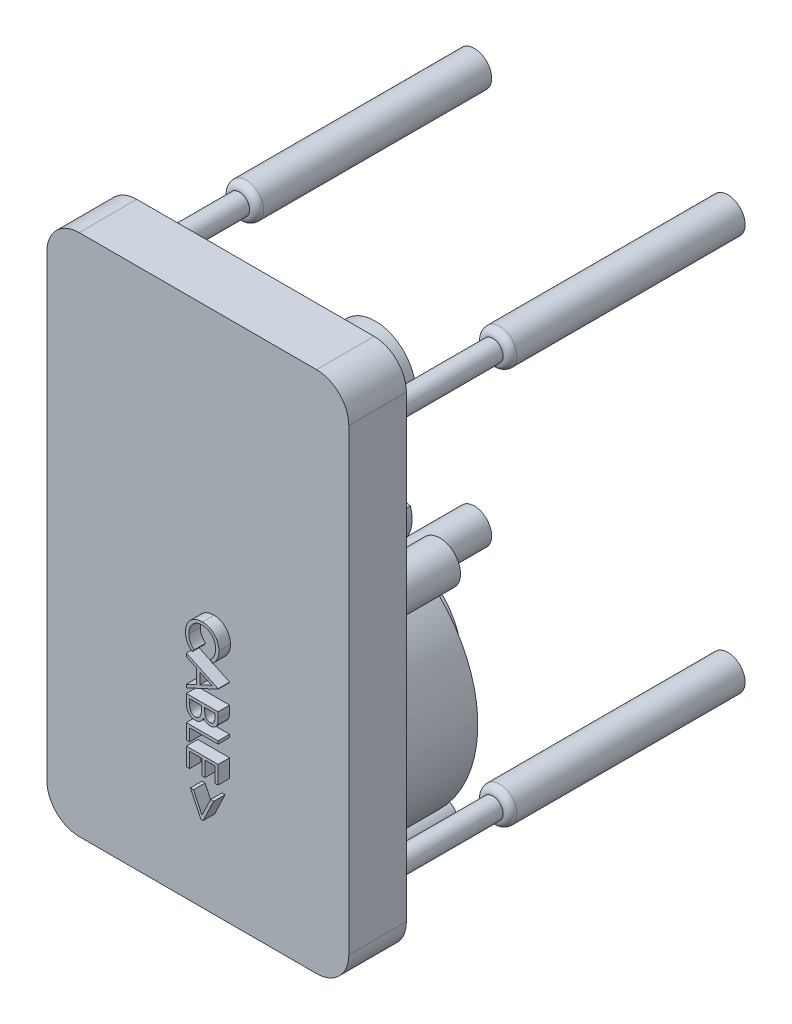
from build123d import *
from build123d.topology import SkipClean

# Parameters (mm, degrees)
SKETCH1_R             = 7.239
BOSS_EXTRUDE1_DEPTH   = 10.16
SKETCH2_R             = 6.35
BOSS_EXTRUDE2_DEPTH   = 1.778
SKETCH3_R             = 2.286
BOSS_EXTRUDE3_DEPTH   = 1.27
BOSS_EXTRUDE4_DEPTH   = 3.302
SKETCH5_R             = 4.445
BOSS_EXTRUDE5_DEPTH   = 11.43
SKETCH6_R             = 1.143
BOSS_EXTRUDE6_DEPTH   = 38.1
BOSS_EXTRUDE6_2_DEPTH = 38.1
BOSS_EXTRUDE6_3_DEPTH = 38.1
BOSS_EXTRUDE6_4_DEPTH = 38.1
SKETCH7_R             = 7.239
BOSS_EXTRUDE7_DEPTH   = 5.334
BOSS_EXTRUDE8_DEPTH   = 6.35
SKETCH9_R             = 1.905
BOSS_EXTRUDE9_DEPTH   = 25.908
BOSS_EXTRUDE10_DEPTH  = 1.27
FILLET1_R             = 0.762


with BuildPart() as part:
    # Sketch1 → Boss-Extrude1 (new body)
    # profile 1 of 7: a face of its own
    with BuildSketch(Plane.XY):
        with BuildLine():
            ThreePointArc((10.064128852, -22.930567504), (13.235964532, -18.24620987), (14.351, -12.7))
            ThreePointArc((14.351, -12.7), (13.235964532, -7.15379013), (10.064128852, -2.469432496))
            ThreePointArc((10.064128852, -2.469432496), (8.455209632, -1.104283934), (6.663505747, 0.010188518))
            ThreePointArc((6.663505747, 0.010188518), (5.175517983, 0.685261096), (3.62043784, 1.186815))
            ThreePointArc((3.62043784, 1.186815), (0, -3.81), (-3.62043784, 1.186815))
            ThreePointArc((-3.62043784, 1.186815), (-5.175517983, 0.685261096), (-6.663505747, 0.010188518))
            ThreePointArc((-6.663505747, 0.010188518), (-8.455209632, -1.104283934), (-10.064128852, -2.469432496))
            ThreePointArc((-10.064128852, -2.469432496), (-14.351, -12.7), (-10.064128852, -22.930567504))
            ThreePointArc((-10.064128852, -22.930567504), (-8.455209632, -24.295716066), (-6.663505747, -25.410188518))
            ThreePointArc((-6.663505747, -25.410188518), (0, -27.051), (6.663505747, -25.410188518))
            ThreePointArc((6.663505747, -25.410188518), (8.455209632, -24.295716066), (10.064128852, -22.930567504))
        make_face()
        with Locations((0, -12.7)):
            Circle(SKETCH1_R, mode=Mode.SUBTRACT)
    # profile 2 of 7: a face of its own
    with BuildSketch(Plane.XY):
        with BuildLine():
            ThreePointArc((-10.064128852, -2.469432496), (-8.455209632, -1.104283934), (-6.663505747, 0.010188518))
            ThreePointArc((-6.663505747, 0.010188518), (-10.236847552, 1.339105214), (-10.064128852, -2.469432496))
        make_face()
    # profile 3 of 7: a face of its own
    with BuildSketch(Plane.XY):
        with BuildLine():
            ThreePointArc((-3.62043784, 1.186815), (0, -3.81), (3.62043784, 1.186815))
            ThreePointArc((3.62043784, 1.186815), (0, 1.651), (-3.62043784, 1.186815))
        make_face()
    # profile 4 of 7: a face of its own
    with BuildSketch(Plane.XY):
        with BuildLine():
            ThreePointArc((6.663505747, 0.010188518), (8.455209632, -1.104283934), (10.064128852, -2.469432496))
            ThreePointArc((10.064128852, -2.469432496), (10.236847552, 1.339105214), (6.663505747, 0.010188518))
        make_face()
    # profile 5 of 7: a face of its own
    with BuildSketch(Plane.XY):
        with BuildLine():
            ThreePointArc((6.663505747, -25.410188518), (10.236847552, -26.739105214), (10.064128852, -22.930567504))
            ThreePointArc((10.064128852, -22.930567504), (8.455209632, -24.295716066), (6.663505747, -25.410188518))
        make_face()
    # profile 6 of 7: a face of its own
    with BuildSketch(Plane.XY):
        with BuildLine():
            ThreePointArc((-10.064128852, -22.930567504), (-10.236847552, -26.739105214), (-6.663505747, -25.410188518))
            ThreePointArc((-6.663505747, -25.410188518), (-8.455209632, -24.295716066), (-10.064128852, -22.930567504))
        make_face()
    # profile 7 of 7: a face of its own
    with BuildSketch(Plane.XY):
        with Locations((0, -12.7)):
            Circle(SKETCH1_R)
    extrude(amount=-BOSS_EXTRUDE1_DEPTH)

    # Sketch3 → Boss-Extrude3 (add)
    with SkipClean():  # the faces are left unmerged after this step: merging them gives an invalid solid
        with BuildSketch(Plane(origin=(0, 0, -10.16), x_dir=(-1, 0, 0), z_dir=(0, 0, -1))):
            with Locations(Location((-8.89, -0.508, 0), (0, 0, 239.094930529))):
                Circle(SKETCH3_R)
            with Locations(Location((8.89, -24.892, 0), (0, 0, 193.101637405))):
                Circle(SKETCH3_R)
            with Locations(Location((-8.89, -24.892, 0), (0, 0, 120.905069471))):
                Circle(SKETCH3_R)
            with Locations(Location((8.89, -0.508, 0), (0, 0, 166.898362595))):
                Circle(SKETCH3_R)
        extrude(amount=BOSS_EXTRUDE3_DEPTH)

    # Sketch4 → Boss-Extrude4 (add)
    with SkipClean():  # the faces are left unmerged after this step: merging them gives an invalid solid
        with BuildSketch(Plane(origin=(0, 0, -10.16), x_dir=(-1, 0, 0), z_dir=(0, 0, -1))):
            with BuildLine():
                ThreePointArc((-3.62043784, 1.186815), (0, -3.81), (3.62043784, 1.186815))
                ThreePointArc((3.62043784, 1.186815), (0, 1.651), (-3.62043784, 1.186815))
            make_face()
        extrude(amount=BOSS_EXTRUDE4_DEPTH)

    # Sketch7 → Boss-Extrude7 (add)
    with SkipClean():  # the faces are left unmerged after this step: merging them gives an invalid solid
        with BuildSketch(Plane(origin=(0, 0, -10.16), x_dir=(-1, 0, 0), z_dir=(0, 0, -1))):
            with Locations(Location((0, -12.7, 0), (0, 0, 180))):
                Circle(SKETCH7_R)
        extrude(amount=BOSS_EXTRUDE7_DEPTH)



with BuildPart() as body_2:
    # Sketch2 → Boss-Extrude2 (new body)
    with BuildSketch(Plane.XY):
        with Locations((0, 14.605)):
            Circle(SKETCH2_R)
    extrude(amount=-BOSS_EXTRUDE2_DEPTH)

    # Sketch5 → Boss-Extrude5 (add)
    with BuildSketch(Plane(origin=(0, 0, -1.778), x_dir=(-1, 0, 0), z_dir=(0, 0, -1))):
        with Locations(Location((0, 12.7, 0), (0, 0, 269.999298311))):
            Circle(SKETCH5_R)
    extrude(amount=BOSS_EXTRUDE5_DEPTH)


with BuildPart() as body_3:
    # Sketch6 → Boss-Extrude6 (new body)
    with BuildSketch(Plane.XY):
        with Locations((-13.97, 21.844)):
            Circle(SKETCH6_R)
    extrude(amount=-BOSS_EXTRUDE6_DEPTH)


with BuildPart() as body_4:
    # Sketch6 → Boss-Extrude6 2 (new body)
    with BuildSketch(Plane.XY):
        with Locations((13.97, 21.844)):
            Circle(SKETCH6_R)
    extrude(amount=-BOSS_EXTRUDE6_2_DEPTH)


with BuildPart() as body_5:
    # Sketch6 → Boss-Extrude6 3 (new body)
    with BuildSketch(Plane.XY):
        with Locations((-13.97, -21.844)):
            Circle(SKETCH6_R)
    extrude(amount=-BOSS_EXTRUDE6_3_DEPTH)


with BuildPart() as body_6:
    # Sketch6 → Boss-Extrude6 4 (new body)
    with BuildSketch(Plane.XY):
        with Locations((13.97, -21.844)):
            Circle(SKETCH6_R)
    extrude(amount=-BOSS_EXTRUDE6_4_DEPTH)


with BuildPart() as part_1:
    with SkipClean():  # the faces are left unmerged after this step: merging them gives an invalid solid
        add(part.part)

        add(body_2.part)  # Boss-Extrude8 merges body 2

        add(body_3.part)  # Boss-Extrude8 merges body 3

        add(body_4.part)  # Boss-Extrude8 merges body 4

        add(body_5.part)  # Boss-Extrude8 merges body 5

        add(body_6.part)  # Boss-Extrude8 merges body 6
        # Sketch8 → Boss-Extrude8 (add)
        with BuildSketch(Plane.XY):
            with BuildLine():
                Line((-13.081, 28.829), (13.081, 28.829))
                ThreePointArc((13.081, 28.829), (15.595471714, 27.787471714), (16.637, 25.273))
                Line((16.637, 25.273), (16.637, -25.273))
                ThreePointArc((16.637, -25.273), (15.595471714, -27.787471714), (13.081, -28.829))
                Line((13.081, -28.829), (-13.081, -28.829))
                ThreePointArc((-13.081, -28.829), (-15.595471714, -27.787471714), (-16.637, -25.273))
                Line((-16.637, -25.273), (-16.637, 25.273))
                ThreePointArc((-16.637, 25.273), (-15.595471714, 27.787471714), (-13.081, 28.829))
            make_face()
        extrude(amount=BOSS_EXTRUDE8_DEPTH)

    # Sketch9 → Boss-Extrude9 (add)
    with SkipClean():  # the faces are left unmerged after this step: merging them gives an invalid solid
        with BuildSketch(Plane(origin=(0, 0, -38.1), x_dir=(-1, 0, 0), z_dir=(0, 0, -1))):
            with Locations((-13.97, 21.844)):
                Circle(SKETCH9_R)
            with Locations((13.97, 21.844)):
                Circle(SKETCH9_R)
            with Locations((13.97, -21.844)):
                Circle(SKETCH9_R)
            with Locations((-13.97, -21.844)):
                Circle(SKETCH9_R)
        extrude(amount=-BOSS_EXTRUDE9_DEPTH)

    # Sketch10 → Boss-Extrude10 (add)
    # profile 1 of 6: a face of its own
    with SkipClean():  # the faces are left unmerged after this step: merging them gives an invalid solid
        with BuildSketch(Plane.XY.offset(6.35)):
            with BuildLine():
                Line((2.857772436, -3.679487179), (2.647435897, -3.404647436))
                add(Edge.make_bspline(
                    [(2.647435897, -3.404647436), (2.670801867, -3.385041548), (2.717218783, -3.346094101), (2.782398327, -3.283434898), (2.843463589, -3.218133255), (2.900705469, -3.150214134), (2.952122234, -3.078455015), (3.000393337, -3.004594216), (3.043661075, -2.927396171), (3.096124061, -2.820644436), (3.150870216, -2.680996588), (3.196773448, -2.505201749), (3.225994623, -2.32169065), (3.229159465, -2.196493051), (3.230769231, -2.1328125)],
                    knots=[0, 0, 0, 0, 0.757959112, 1.505699292, 2.245454638, 2.979532153, 3.711538275, 4.438200793, 5.171680507, 5.909471876, 7.393775596, 8.890124382, 10.418191784, 12, 12, 12, 12], degree=3))
                add(Edge.make_bspline(
                    [(3.230769231, -2.1328125), (3.230363445, -2.097729627), (3.229555641, -2.027889483), (3.218973416, -1.924234716), (3.20392868, -1.822319184), (3.1821483, -1.722521872), (3.153792222, -1.625040935), (3.120538112, -1.529134135), (3.079156746, -1.435930999), (3.033456552, -1.34430985), (2.981823731, -1.256534692), (2.925523467, -1.173466714), (2.865108338, -1.095485416), (2.800734294, -1.02237471), (2.731601295, -0.954936411), (2.658522608, -0.892089722), (2.580618642, -0.834967287), (2.499350418, -0.782165421), (2.41459849, -0.735181205), (2.326896016, -0.694608059), (2.236578315, -0.6598335), (2.143460367, -0.632062149), (2.047908611, -0.610157149), (1.949720267, -0.59502418), (1.849085923, -0.584537152), (1.780876701, -0.583736779), (1.746494391, -0.583333333)],
                    knots=[0, 0, 0, 0, 1.055000685, 2.100209969, 3.131349012, 4.153242145, 5.170189196, 6.184191144, 7.204341339, 8.235672124, 9.263040994, 10.265373269, 11.252624173, 12.22887325, 13.193405896, 14.155809299, 15.126090485, 16.097288279, 17.069732292, 18.038585918, 19.002221264, 19.978698174, 20.959418239, 21.948869816, 22.966084182, 24, 24, 24, 24], degree=3))
                add(Edge.make_bspline(
                    [(1.746494391, -0.583333333), (1.694763071, -0.584595152), (1.593195486, -0.587072567), (1.444424876, -0.609120901), (1.301904202, -0.642625992), (1.16652436, -0.692841569), (1.036616002, -0.75476062), (0.914377148, -0.833001231), (0.797960584, -0.923617768), (0.690117636, -1.027892188), (0.591603911, -1.142298004), (0.504853329, -1.265045915), (0.432538447, -1.395830203), (0.3723625, -1.533206833), (0.326105772, -1.678232947), (0.293541649, -1.83064775), (0.272299468, -1.990119745), (0.27026578, -2.099089145), (0.269230769, -2.154547276)],
                    knots=[0, 0, 0, 0, 1.029171465, 2.020641659, 2.987623507, 3.938342917, 4.889210282, 5.84687017, 6.821220943, 7.821438502, 8.827599549, 9.822697543, 10.807740252, 11.797342354, 12.80366471, 13.83203677, 14.896651826, 16, 16, 16, 16], degree=3))
                add(Edge.make_bspline(
                    [(0.269230769, -2.154547276), (0.270919549, -2.215649965), (0.274243472, -2.335914674), (0.302402721, -2.5122827), (0.348060638, -2.681118466), (0.411958561, -2.842431052), (0.495023849, -2.995765698), (0.595721726, -3.141362359), (0.715010059, -3.279343929), (0.806093187, -3.362315211), (0.852564103, -3.404647436)],
                    knots=[0, 0, 0, 0, 1.028121516, 2.023589091, 2.998037872, 3.967518031, 4.937445131, 5.927275754, 6.942489185, 8, 8, 8, 8], degree=3))
                Line((0.852564103, -3.404647436), (0.644330929, -3.679487179))
                add(Edge.make_bspline(
                    [(0.644330929, -3.679487179), (0.615792429, -3.657369099), (0.558852125, -3.613238882), (0.478581139, -3.54178043), (0.403074401, -3.466504759), (0.332956835, -3.386842997), (0.266764666, -3.303747898), (0.206716932, -3.215755784), (0.150984484, -3.12438645), (0.100628049, -3.02910793), (0.05547798, -2.930233036), (0.017361042, -2.827864665), (-0.015946051, -2.722870088), (-0.04316627, -2.615196429), (-0.064445988, -2.50448398), (-0.078663293, -2.391112597), (-0.088405847, -2.274842967), (-0.089293675, -2.196401513), (-0.08974359, -2.156650641)],
                    knots=[0, 0, 0, 0, 0.986756325, 1.968786143, 2.935506311, 3.899499537, 4.868307269, 5.8376204, 6.809456583, 7.792545619, 8.781780509, 9.778496008, 10.776623214, 11.79151764, 12.812666265, 13.856269958, 14.913646641, 16, 16, 16, 16], degree=3))
                add(Edge.make_bspline(
                    [(-0.08974359, -2.156650641), (-0.089481597, -2.119006974), (-0.088963539, -2.044571284), (-0.080571372, -1.934672532), (-0.069121635, -1.827682951), (-0.051881504, -1.723908326), (-0.031537164, -1.622782351), (-0.004265907, -1.525221766), (0.026283259, -1.430266556), (0.062188246, -1.338298215), (0.102704429, -1.249238515), (0.148495987, -1.163374704), (0.199177852, -1.080746271), (0.253632863, -1.000540851), (0.313610164, -0.923943267), (0.378276799, -0.850289742), (0.44741481, -0.779167265), (0.497269663, -0.73516458), (0.522335737, -0.713040865)],
                    knots=[0, 0, 0, 0, 1.114604814, 2.203992996, 3.262667896, 4.300477797, 5.318619304, 6.316056647, 7.298880507, 8.271930387, 9.238335007, 10.195173496, 11.151986948, 12.108099108, 13.064862484, 14.031167946, 15.010108607, 16, 16, 16, 16], degree=3))
                add(Edge.make_bspline(
                    [(0.522335737, -0.713040865), (0.565876926, -0.677605222), (0.652433637, -0.607161745), (0.792719618, -0.517036062), (0.939187827, -0.439888506), (1.092607755, -0.377512586), (1.252635143, -0.328749852), (1.419350657, -0.294968657), (1.592598599, -0.273017053), (1.710435388, -0.270506764), (1.770332532, -0.269230769)],
                    knots=[0, 0, 0, 0, 0.994628077, 1.977248131, 2.950237994, 3.925870899, 4.908910175, 5.911660606, 6.938484602, 8, 8, 8, 8], degree=3))
                add(Edge.make_bspline(
                    [(1.770332532, -0.269230769), (1.833285352, -0.270792919), (1.957141094, -0.27386635), (2.138952641, -0.299762866), (2.312890308, -0.341927395), (2.479623367, -0.399988234), (2.638197835, -0.476586004), (2.789283438, -0.569313798), (2.93275681, -0.679077345), (3.066783632, -0.804498118), (3.18931972, -0.9420727), (3.297126777, -1.089389619), (3.386844068, -1.246172066), (3.461840291, -1.410689784), (3.519484737, -1.584175502), (3.559837929, -1.766258861), (3.584955044, -1.956597778), (3.588130252, -2.086460203), (3.58974359, -2.15244391)],
                    knots=[0, 0, 0, 0, 1.032901378, 2.032168977, 3.007206631, 3.966850309, 4.924221947, 5.891988639, 6.871730993, 7.884084801, 8.900290346, 9.89161143, 10.874607481, 11.860025555, 12.854717796, 13.869097222, 14.917278314, 16, 16, 16, 16], degree=3))
                add(Edge.make_bspline(
                    [(3.58974359, -2.15244391), (3.589261812, -2.192658461), (3.588308181, -2.272259114), (3.578996816, -2.390010625), (3.563502411, -2.50465715), (3.542274027, -2.616475949), (3.516255146, -2.725872498), (3.482194419, -2.83172447), (3.442641565, -2.934608269), (3.39824916, -3.03460095), (3.347498469, -3.130614623), (3.292377899, -3.222631813), (3.231615083, -3.309542503), (3.167218841, -3.392981488), (3.096780331, -3.471070292), (3.022593437, -3.546039113), (2.942456775, -3.615298244), (2.886052222, -3.658051701), (2.857772436, -3.679487179)],
                    knots=[0, 0, 0, 0, 1.096705196, 2.170817488, 3.219277236, 4.250701065, 5.274195539, 6.284202015, 7.28098643, 8.279664616, 9.266225751, 10.241373748, 11.203306326, 12.157093976, 13.114198862, 14.069774147, 15.032234603, 16, 16, 16, 16], degree=3))
            make_face()
        # profile 2 of 6: a face of its own
        with BuildSketch(Plane.XY.offset(6.35)):
            Polygon((3.5, -5.833333333), (0, -7.448717949), (0, -7.107271635), (1.121794872, -6.58984375), (1.121794872, -5.003205128), (0, -4.471053686), (0, -4.128205128), (3.5, -5.788461538), align=None)
            Polygon((2.817808494, -5.807391827), (1.480769231, -5.173577724), (1.480769231, -6.424379006), align=None, mode=Mode.SUBTRACT)
        # profile 3 of 6: a face of its own
        with BuildSketch(Plane.XY.offset(6.35)):
            with BuildLine():
                Line((3.5, -7.987179487), (3.5, -8.670072115))
                add(Edge.make_bspline(
                    [(3.5, -8.670072115), (3.49982425, -8.703500594), (3.499483602, -8.768293304), (3.49420047, -8.862512746), (3.486996801, -8.950761556), (3.475566708, -9.033065329), (3.461774931, -9.109386031), (3.445073115, -9.179953668), (3.425046501, -9.244543841), (3.39320022, -9.321656577), (3.345877051, -9.409577238), (3.275948486, -9.504775631), (3.190416023, -9.58617987), (3.093933368, -9.656366187), (2.987797596, -9.712167307), (2.874538407, -9.752536604), (2.755616665, -9.778094479), (2.673973487, -9.780722914), (2.63271234, -9.782051282)],
                    knots=[0, 0, 0, 0, 1.001505555, 1.941167018, 2.826882275, 3.653841531, 4.429895133, 5.150066043, 5.825578002, 6.45369114, 7.647487171, 8.808567382, 9.977351308, 11.170798116, 12.373658725, 13.556498008, 14.765093433, 16, 16, 16, 16], degree=3))
                add(Edge.make_bspline(
                    [(2.63271234, -9.782051282), (2.594053235, -9.780979192), (2.518084448, -9.778872435), (2.407150679, -9.758040783), (2.301116128, -9.727025424), (2.201287981, -9.682000287), (2.108949247, -9.624084028), (2.02464869, -9.554388494), (1.950429264, -9.471406851), (1.909109541, -9.409135189), (1.888120994, -9.377504006)],
                    knots=[0, 0, 0, 0, 1.044266239, 2.052081639, 3.041743201, 4.026043445, 5.00270663, 5.980942822, 6.97441044, 8, 8, 8, 8], degree=3))
                add(Edge.make_bspline(
                    [(1.888120994, -9.377504006), (1.872867775, -9.417271093), (1.843684588, -9.49335538), (1.791808319, -9.598132695), (1.736021049, -9.688767398), (1.674776106, -9.76535925), (1.607935032, -9.829876034), (1.536836284, -9.887813444), (1.45797957, -9.936352004), (1.37361028, -9.978050718), (1.284320561, -10.010867169), (1.190518767, -10.034086961), (1.093253774, -10.048354394), (1.026957798, -10.050299901), (0.993489583, -10.051282051)],
                    knots=[0, 0, 0, 0, 1.272302504, 2.434229863, 3.488457646, 4.447234501, 5.35599188, 6.26022912, 7.18267843, 8.11661068, 9.06895546, 10.019249207, 11.000057067, 12, 12, 12, 12], degree=3))
                add(Edge.make_bspline(
                    [(0.993489583, -10.051282051), (0.959322905, -10.050304899), (0.892099008, -10.048382324), (0.793341106, -10.034206731), (0.698976329, -10.010181531), (0.60833373, -9.977169594), (0.521926377, -9.933840061), (0.438672091, -9.882245878), (0.36078871, -9.819449219), (0.286424081, -9.749453453), (0.219600708, -9.670175718), (0.160109352, -9.584653658), (0.110959363, -9.491657184), (0.070188246, -9.392628424), (0.038590839, -9.286909331), (0.016654453, -9.174891884), (0.001839273, -9.056551741), (0.000623494, -8.975341406), (0, -8.93369391)],
                    knots=[0, 0, 0, 0, 0.978404568, 1.925038397, 2.85041836, 3.763147166, 4.682162379, 5.614488577, 6.562659439, 7.54271123, 8.535210642, 9.526693784, 10.520907202, 11.541451354, 12.589717429, 13.675358278, 14.807842563, 16, 16, 16, 16], degree=3))
                Line((0, -8.93369391), (0, -7.987179487))
                Line((0, -7.987179487), (3.5, -7.987179487))
            make_face()
            with BuildLine():
                Line((3.141025641, -8.301282051), (2.019230769, -8.301282051))
                Line((2.019230769, -8.301282051), (2.019230769, -8.512319712))
                add(Edge.make_bspline(
                    [(2.019230769, -8.512319712), (2.019627364, -8.543168785), (2.020393667, -8.602775481), (2.022657945, -8.689324772), (2.028720383, -8.769462091), (2.035132411, -8.843463576), (2.045005621, -8.910833237), (2.057087658, -8.97179661), (2.069753809, -9.026901337), (2.091355012, -9.090420305), (2.122955643, -9.162449973), (2.173150423, -9.238748286), (2.231312009, -9.307103551), (2.299660574, -9.364179334), (2.374282065, -9.411276833), (2.455183134, -9.44270766), (2.539205431, -9.465001132), (2.597038901, -9.466956125), (2.626402244, -9.467948718)],
                    knots=[0, 0, 0, 0, 1.156481963, 2.23455883, 3.244418989, 4.168404366, 5.01828131, 5.794834307, 6.498111525, 7.13526334, 8.307595709, 9.435046769, 10.546766856, 11.659452936, 12.760769924, 13.837671619, 14.902137667, 16, 16, 16, 16], degree=3))
                add(Edge.make_bspline(
                    [(2.626402244, -9.467948718), (2.645837164, -9.46745228), (2.683960884, -9.466478463), (2.739322416, -9.457615573), (2.792056229, -9.444755433), (2.84094948, -9.424663971), (2.887391857, -9.40036924), (2.929320542, -9.368766205), (2.969032638, -9.333075662), (3.005070015, -9.291160594), (3.037359647, -9.243223955), (3.06577169, -9.188808998), (3.088183923, -9.12726598), (3.108288888, -9.059990319), (3.122239543, -8.985905328), (3.133904149, -8.905734918), (3.13983359, -8.81879898), (3.140619428, -8.758654053), (3.141025641, -8.727564103)],
                    knots=[0, 0, 0, 0, 0.911752476, 1.788502045, 2.626783689, 3.45400582, 4.26402138, 5.080402872, 5.911472738, 6.767166405, 7.66795952, 8.620018292, 9.640966946, 10.73819047, 11.913090943, 13.176185384, 14.540321519, 16, 16, 16, 16], degree=3))
                Line((3.141025641, -8.727564103), (3.141025641, -8.301282051))
            make_face(mode=Mode.SUBTRACT)
            with BuildLine():
                Line((1.66025641, -8.301282051), (0.358974359, -8.301282051))
                Line((0.358974359, -8.301282051), (0.358974359, -8.748597756))
                add(Edge.make_bspline(
                    [(0.358974359, -8.748597756), (0.359356766, -8.780616841), (0.360093805, -8.842329406), (0.362526199, -8.931428523), (0.367942779, -9.013786891), (0.376773248, -9.089451901), (0.385948875, -9.159089613), (0.398648387, -9.222008173), (0.413086196, -9.278304041), (0.43542939, -9.343572232), (0.470080688, -9.417115598), (0.522667742, -9.496314398), (0.584492161, -9.56743167), (0.656948104, -9.627131057), (0.735135085, -9.676428471), (0.81864416, -9.711003623), (0.904927716, -9.733234951), (0.963909533, -9.735861995), (0.993489583, -9.737179487)],
                    knots=[0, 0, 0, 0, 1.159821618, 2.235403267, 3.228114831, 4.14795534, 4.994323282, 5.771256229, 6.471395042, 7.097801288, 8.267864287, 9.404187171, 10.531774336, 11.667624178, 12.792825787, 13.866573821, 14.930062559, 16, 16, 16, 16], degree=3))
                add(Edge.make_bspline(
                    [(0.993489583, -9.737179487), (1.011985316, -9.736910196), (1.048678445, -9.736375957), (1.102559382, -9.728016016), (1.154984973, -9.716353352), (1.205162465, -9.699464814), (1.253908353, -9.678169735), (1.30037356, -9.651445218), (1.345669087, -9.620583465), (1.402867072, -9.572305486), (1.468791298, -9.502150596), (1.533326389, -9.402438104), (1.585374877, -9.28906742), (1.607474256, -9.206839697), (1.618890224, -9.164362981)],
                    knots=[0, 0, 0, 0, 0.723503378, 1.435336582, 2.130201219, 2.824764462, 3.504949994, 4.209866579, 4.920640069, 5.648298893, 7.13757748, 8.670694625, 10.280166878, 12, 12, 12, 12], degree=3))
                add(Edge.make_bspline(
                    [(1.618890224, -9.164362981), (1.622345541, -9.147333901), (1.629837379, -9.110411343), (1.637740616, -9.050203457), (1.644830077, -8.981237103), (1.64993647, -8.903807058), (1.655418093, -8.81760537), (1.657474037, -8.722659733), (1.659983424, -8.618903025), (1.660163087, -8.546910565), (1.66025641, -8.509515224)],
                    knots=[0, 0, 0, 0, 0.634452549, 1.375623993, 2.216454381, 3.166361212, 4.209414599, 5.370755378, 6.634280627, 8, 8, 8, 8], degree=3))
                Line((1.66025641, -8.509515224), (1.66025641, -8.301282051))
            make_face(mode=Mode.SUBTRACT)
        # profile 4 of 6: a face of its own
        with BuildSketch(Plane.XY.offset(6.35)):
            Polygon((3.5, -10.769230769), (3.5, -11.083333333), (0.358974359, -11.083333333), (0.358974359, -12.429487179), (0, -12.429487179), (0, -10.769230769), align=None)
        # profile 5 of 6: a face of its own
        with BuildSketch(Plane.XY.offset(6.35)):
            Polygon((3.5, -13.012820513), (3.5, -14.987179487), (3.141025641, -14.987179487), (3.141025641, -13.326923077), (2.064102564, -13.326923077), (2.064102564, -14.987179487), (1.705128205, -14.987179487), (1.705128205, -13.326923077), (0.358974359, -13.326923077), (0.358974359, -14.987179487), (0, -14.987179487), (0, -13.012820513), align=None)
        # profile 6 of 6: a face of its own
        with BuildSketch(Plane.XY.offset(6.35)):
            Polygon((0.790164263, -16.782051282), (1.727564103, -18.746594551), (2.664963942, -16.782051282), (3.006410256, -16.782051282), (1.850260417, -19.205128205), (1.604867788, -19.205128205), (0.448717949, -16.782051282), align=None)
        extrude(amount=BOSS_EXTRUDE10_DEPTH)

    # Fillet1
    fillet1_edges = [part_1.edges().sort_by_distance(p)[0] for p in [
        (15.875, 21.844, -12.192),
        (-12.065, 21.844, -12.192),
        (-12.065, -21.844, -12.192),
        (15.875, -21.844, -12.192),
    ]]
    fillet(fillet1_edges, radius=FILLET1_R - 0.0001)  # a hair under: the kernel refuses the full size


solid = part_1.part
